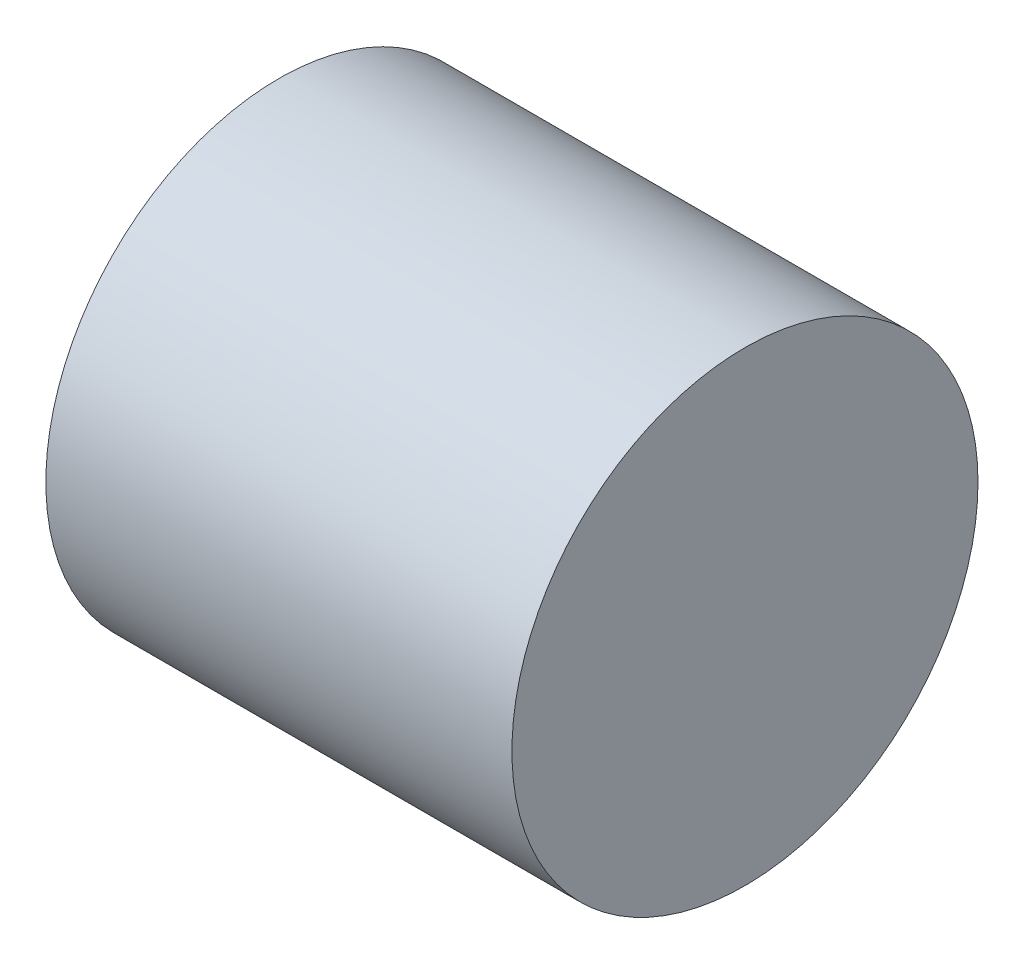
from build123d import *

# Parameters (mm, degrees)
SKETCH1_R           = 5
BOSS_EXTRUDE1_DEPTH = 10


# Read off the part's stored shape, not the designer's step: Surface-Imported1
with BuildPart() as part:
    # Sketch1 → Boss-Extrude1 (new body)
    with BuildSketch(Plane(origin=(20.6, 0, 0), x_dir=(0, 0, -1), z_dir=(1, 0, 0))):
        Circle(SKETCH1_R)
    extrude(amount=-BOSS_EXTRUDE1_DEPTH)


solid = part.part
